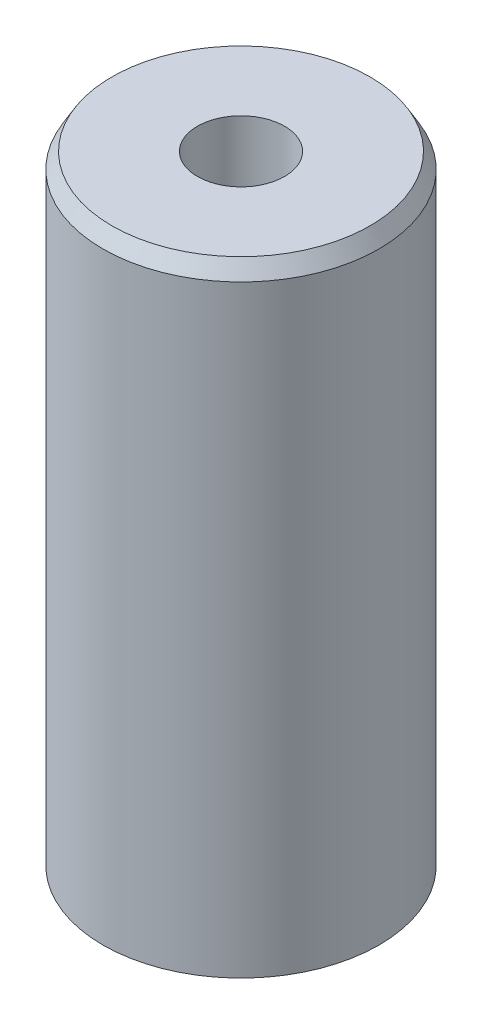
from build123d import *
from OCP.BRepFilletAPI import BRepFilletAPI_MakeChamfer

# Parameters (mm, degrees)
SKETCH1_R           = 12.5
BOSS_EXTRUDE1_DEPTH = 56.815133741
SKETCH2_R           = 3.946307094
CUT_EXTRUDE1_DEPTH  = 60.501759823
CHAMFER1_SIZE       = 1.407975621
CHAMFER1_SIZE2      = 0.812895104


with BuildPart() as part:
    # Sketch1 → Boss-Extrude1 (new body)
    with BuildSketch(Plane(origin=(0, 0, 0), x_dir=(1, 0, 0), z_dir=(0, 1, 0))):
        Circle(SKETCH1_R)
    extrude(amount=BOSS_EXTRUDE1_DEPTH)

    # Sketch2 → Cut-Extrude1 (cut, through all)
    with BuildSketch(Plane(origin=(0, 0, 0), x_dir=(1, 0, 0), z_dir=(0, 1, 0))):
        Circle(SKETCH2_R)
    extrude(amount=CUT_EXTRUDE1_DEPTH, mode=Mode.SUBTRACT)

    # Chamfer1: one chamfer whose edges measure the first distance from different faces: ONE call of the kernel's chamfer builder (chamfer() names one face for all edges)
    chamfer1_edges_1 = [part.edges().sort_by_distance(p)[0] for p in [
        (-12.5, 56.815133741, 0),
    ]]
    chamfer1_side_1 = [part.faces().sort_by_distance(p)[0] for p in [
        (-12.5, 28.407566871, 0),
    ]]
    chamfer1_edges_2 = [part.edges().sort_by_distance(p)[0] for p in [
        (-12.5, 0, 0),
    ]]
    chamfer1_side_2 = [part.faces().sort_by_distance(p)[0] for p in [
        (-12.146446609, 0, 0),
    ]]
    chamfer1 = BRepFilletAPI_MakeChamfer(part.part.solid().wrapped)
    for e in chamfer1_edges_1:
        chamfer1.Add(CHAMFER1_SIZE, CHAMFER1_SIZE2, e.wrapped, chamfer1_side_1[0].wrapped)  # the first distance lies on this face
    for e in chamfer1_edges_2:
        chamfer1.Add(CHAMFER1_SIZE, CHAMFER1_SIZE2, e.wrapped, chamfer1_side_2[0].wrapped)  # the first distance lies on this face
    add(Compound.cast(chamfer1.Shape()), mode=Mode.REPLACE)


solid = part.part
